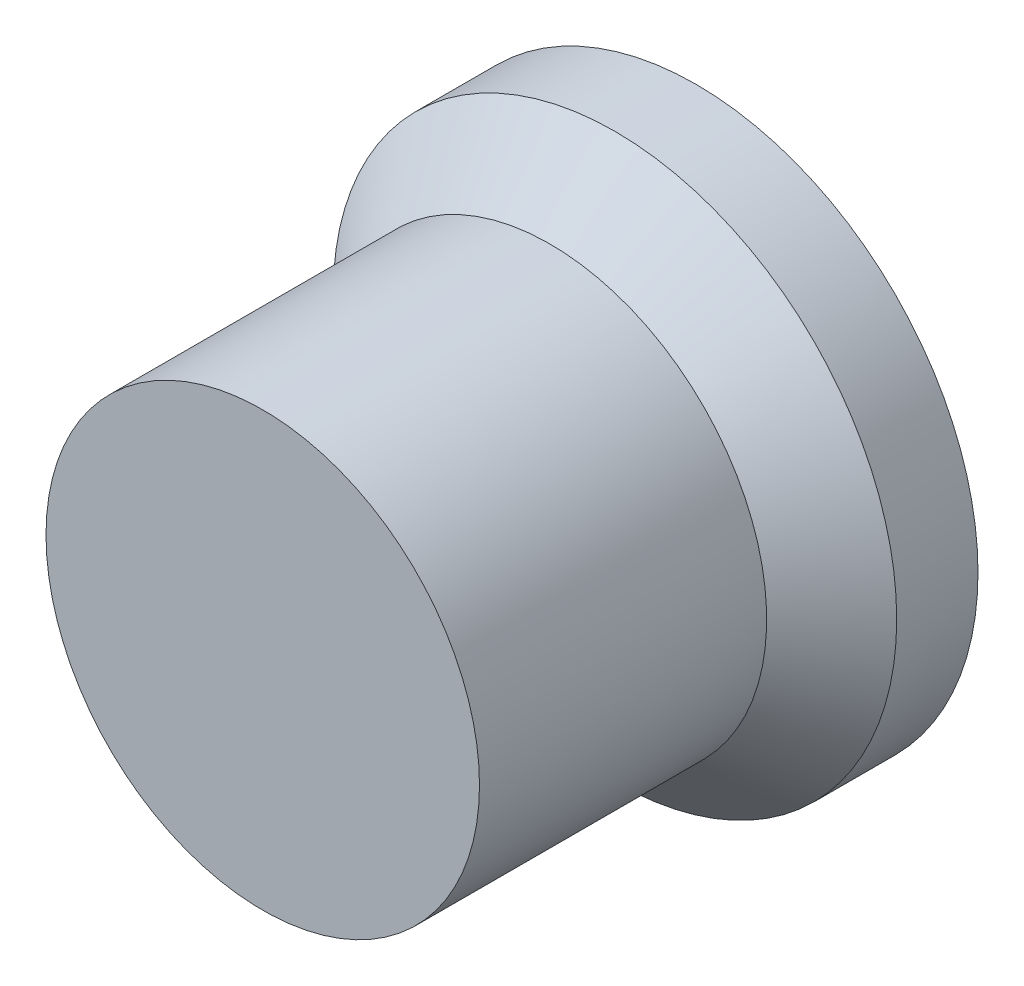
from build123d import *

# Parameters (mm, degrees)
SKETCH1_R           = 2
BOSS_EXTRUDE1_DEPTH = 4
SKETCH2_R           = 2.6
BOSS_EXTRUDE2_DEPTH = 1.75
CHAMFER1_SIZE       = 1


with BuildPart() as part:
    # Sketch1 → Boss-Extrude1 (new body)
    with BuildSketch(Plane.XY):
        Circle(SKETCH1_R)
    extrude(amount=BOSS_EXTRUDE1_DEPTH)

    # Sketch2 → Boss-Extrude2 (add)
    with BuildSketch(Plane(origin=(0, 0, 0), x_dir=(-1, 0, 0), z_dir=(0, 0, -1))):
        Circle(SKETCH2_R)
    extrude(amount=-BOSS_EXTRUDE2_DEPTH)

    # Chamfer1
    # the kernel refuses this chamfer: 1 mm, written as the material it takes off along each edge
    with BuildSketch(Plane(origin=(0, 0, 1.75), x_dir=(-1, 0, 0), z_dir=(0, -1, 0))) as chamfer1_piece_1_section:
        Polygon((2.6, CHAMFER1_SIZE), (2.6 - CHAMFER1_SIZE, 0), (2.6, 0), align=None)
    chamfer1_piece_1 = revolve(axis=Axis((0, 0, 1.75), (0, 0, -1)), mode=Mode.PRIVATE)
    chamfer1_piece_1 = chamfer1_piece_1 - Plane(origin=(0, 0, 1.049223844), x_dir=(1, 0, 0), z_dir=(0, 0, -1)) * Cylinder(2, 11, mode=Mode.PRIVATE)
    add(chamfer1_piece_1, mode=Mode.SUBTRACT)


solid = part.part
